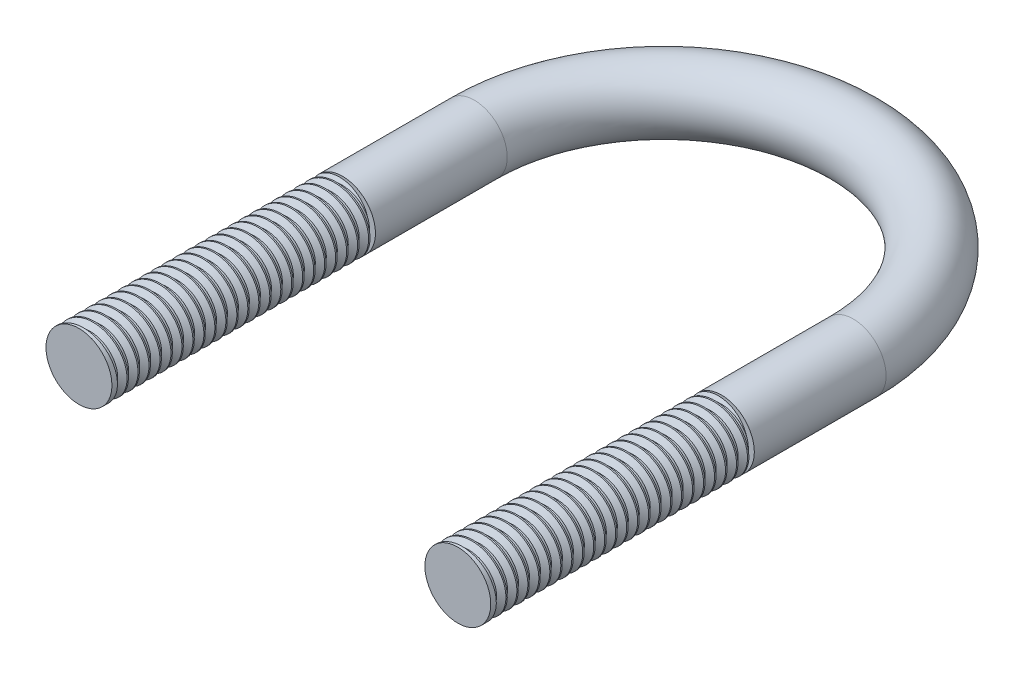
from build123d import *

# Parameters (mm, degrees)
SKETCH1_W        = 3.175
SKETCH1_H        = 25.4
SKETCH2_W        = 3.175
SKETCH2_H        = 25.4
SKETCH3_W        = 3.175
SKETCH3_H        = 12.7
SKETCH4_W        = 3.175
SKETCH4_H        = 12.7
SWEEP1_OUTLINE_R = 3.175
SWEEP1_ANGLE     = 180
THREAD1_PITCH    = 1.058333333
THREAD1_TO       = 25.4
THREAD2_PITCH    = 1.058333333
THREAD2_TO       = 25.4


with BuildPart() as part:
    # Sketch1 → Revolve-Thin2 (revolve)
    with BuildSketch(Plane(origin=(0, 0, 0), x_dir=(1, 0, 0), z_dir=(0, 1, 0)), mode=Mode.PRIVATE) as revolve_thin2_sk:
        with Locations((-1.5875, 12.7)):
            Rectangle(SKETCH1_W, SKETCH1_H)
    revolve(revolve_thin2_sk.sketch.rotate(Axis((0, 0, 0), (0, 0, -1)), 180), axis=Axis((0, 0, 0), (0, 0, -1)))

    # Thread1: arcs per turn and ends read off the stored shape
    # Thread1: the profile of Thread Profile1 profile screwed along a right-hand helix through 24 turns, 8 arcs to a turn; built about Z, then put on its axis
    thread1_z = Axis((0, 0, 0), (0, 0, 1))
    thread1_corners = [(3.1753, 0, -0.000173205), (3.1753, 0, 0.926214869), (2.602160282, 0, 0.595312499), (2.602160282, 0, 0.330729165)]
    with BuildLine(mode=Mode.PRIVATE) as thread1_profile:
        Line(thread1_corners[0], thread1_corners[1])
        Line(thread1_corners[1], thread1_corners[2])
        Line(thread1_corners[2], thread1_corners[3])
        Line(thread1_corners[3], thread1_corners[0])
    thread1_cap = Face(thread1_profile.wire())
    thread1_turn_angles = [0, 22.5, 45, 67.5, 90, 112.5, 135, 157.5, 180, 202.5, 225, 247.5, 270, 292.5, 315, 337.5, 360]
    thread1_turn_weights = [1, 0.9238795325112867, 1, 0.9238795325112867, 1, 0.9238795325112867, 1, 0.9238795325112867, 1, 0.9238795325112867, 1, 0.9238795325112867, 1, 0.9238795325112867, 1, 0.9238795325112867, 1]
    thread1_turn_rails = [Edge.make_bspline([Vector(p[0], p[1], 0).rotate(thread1_z, thread1_turn_angles[k]) / thread1_turn_weights[k] + Vector(0, 0, p[2] + THREAD1_PITCH * thread1_turn_angles[k] / 360) for k in range(17)], [0, 0, 0, 1, 1, 2, 2, 3, 3, 4, 4, 5, 5, 6, 6, 7, 7, 8, 8, 8], 2, thread1_turn_weights) for p in thread1_corners]
    thread1_turn_sides = [Face.make_surface_from_curves(thread1_turn_rails[p[0]], thread1_turn_rails[p[1]]) for p in [(0, 1), (1, 2), (2, 3), (3, 0)]]
    thread1 = Plane(origin=(0, 0, 0), x_dir=(-1, 0, 0), z_dir=(0, 0, -1)) * split(Solid(Shell([*[p.moved(Location((0, 0, THREAD1_PITCH * i))) for i in range(24) for p in thread1_turn_sides], thread1_cap, thread1_cap.rotate(thread1_z, 8640).moved(Location((0, 0, THREAD1_PITCH * 8640 / 360)))])), bisect_by=Plane.XY.offset(THREAD1_TO), keep=Keep.BOTTOM, mode=Mode.PRIVATE)
    add(thread1, mode=Mode.SUBTRACT)


with BuildPart() as body_2:
    # Sketch2 → Revolve-Thin3 (revolve)
    with BuildSketch(Plane(origin=(0, 0, 0), x_dir=(1, 0, 0), z_dir=(0, 1, 0)), mode=Mode.PRIVATE) as revolve_thin3_sk:
        with Locations((34.925, 12.7)):
            Rectangle(SKETCH2_W, SKETCH2_H)
    revolve(revolve_thin3_sk.sketch.rotate(Axis((36.5125, 0, 0), (0, 0, -1)), 180), axis=Axis((36.5125, 0, 0), (0, 0, -1)))

    # Thread2: arcs per turn and ends read off the stored shape
    # Thread2: the profile of Thread Profile2 profile screwed along a right-hand helix through 24 turns, 8 arcs to a turn; built about Z, then put on its axis
    thread2_z = Axis((0, 0, 0), (0, 0, 1))
    thread2_corners = [(3.1753, 0, -0.000173205), (3.1753, 0, 0.926214869), (2.602160282, 0, 0.595312499), (2.602160282, 0, 0.330729165)]
    with BuildLine(mode=Mode.PRIVATE) as thread2_profile:
        Line(thread2_corners[0], thread2_corners[1])
        Line(thread2_corners[1], thread2_corners[2])
        Line(thread2_corners[2], thread2_corners[3])
        Line(thread2_corners[3], thread2_corners[0])
    thread2_cap = Face(thread2_profile.wire())
    thread2_turn_angles = [0, 22.5, 45, 67.5, 90, 112.5, 135, 157.5, 180, 202.5, 225, 247.5, 270, 292.5, 315, 337.5, 360]
    thread2_turn_weights = [1, 0.9238795325112867, 1, 0.9238795325112867, 1, 0.9238795325112867, 1, 0.9238795325112867, 1, 0.9238795325112867, 1, 0.9238795325112867, 1, 0.9238795325112867, 1, 0.9238795325112867, 1]
    thread2_turn_rails = [Edge.make_bspline([Vector(p[0], p[1], 0).rotate(thread2_z, thread2_turn_angles[k]) / thread2_turn_weights[k] + Vector(0, 0, p[2] + THREAD2_PITCH * thread2_turn_angles[k] / 360) for k in range(17)], [0, 0, 0, 1, 1, 2, 2, 3, 3, 4, 4, 5, 5, 6, 6, 7, 7, 8, 8, 8], 2, thread2_turn_weights) for p in thread2_corners]
    thread2_turn_sides = [Face.make_surface_from_curves(thread2_turn_rails[p[0]], thread2_turn_rails[p[1]]) for p in [(0, 1), (1, 2), (2, 3), (3, 0)]]
    thread2 = Plane(origin=(36.5125, 0, 0), x_dir=(-1, 0, 0), z_dir=(0, 0, -1)) * split(Solid(Shell([*[p.moved(Location((0, 0, THREAD2_PITCH * i))) for i in range(24) for p in thread2_turn_sides], thread2_cap, thread2_cap.rotate(thread2_z, 8640).moved(Location((0, 0, THREAD2_PITCH * 8640 / 360)))])), bisect_by=Plane.XY.offset(THREAD2_TO), keep=Keep.BOTTOM, mode=Mode.PRIVATE)
    add(thread2, mode=Mode.SUBTRACT)


with BuildPart() as body_3:
    # Sketch3 → Revolve-Thin5 (revolve)
    with BuildSketch(Plane(origin=(0, 0, 0), x_dir=(1, 0, 0), z_dir=(0, 1, 0)), mode=Mode.PRIVATE) as revolve_thin5_sk:
        with Locations((-1.5875, 31.75)):
            Rectangle(SKETCH3_W, SKETCH3_H)
    revolve(revolve_thin5_sk.sketch.rotate(Axis((0, 0, -25.4), (0, 0, -1)), 180), axis=Axis((0, 0, -25.4), (0, 0, -1)))



with BuildPart() as body_4:
    # Sketch4 → Revolve-Thin6 (revolve)
    with BuildSketch(Plane(origin=(0, 0, 0), x_dir=(1, 0, 0), z_dir=(0, 1, 0)), mode=Mode.PRIVATE) as revolve_thin6_sk:
        with Locations((34.925, 31.75)):
            Rectangle(SKETCH4_W, SKETCH4_H)
    revolve(revolve_thin6_sk.sketch.rotate(Axis((36.5125, 0, -25.4), (0, 0, -1)), 180), axis=Axis((36.5125, 0, -25.4), (0, 0, -1)))


with BuildPart() as body_3_1:
    add(body_3.part)

    add(body_4.part)  # Sweep1 merges body 4
    # Sweep1: read off the stored shape, not the designer's step
    # Sweep1 outline → Sweep1 (revolve)
    with BuildSketch(Plane(origin=(18.25625, 0, -38.1), x_dir=(1, 0, 0), z_dir=(0, 0, 1))):
        with Locations((18.25625, 0)):
            Circle(SWEEP1_OUTLINE_R)
    revolve(axis=Axis((18.25625, 0, -38.1), (0, 1, 0)), revolution_arc=SWEEP1_ANGLE)


solid = Compound([part.part, body_2.part, body_3_1.part])
